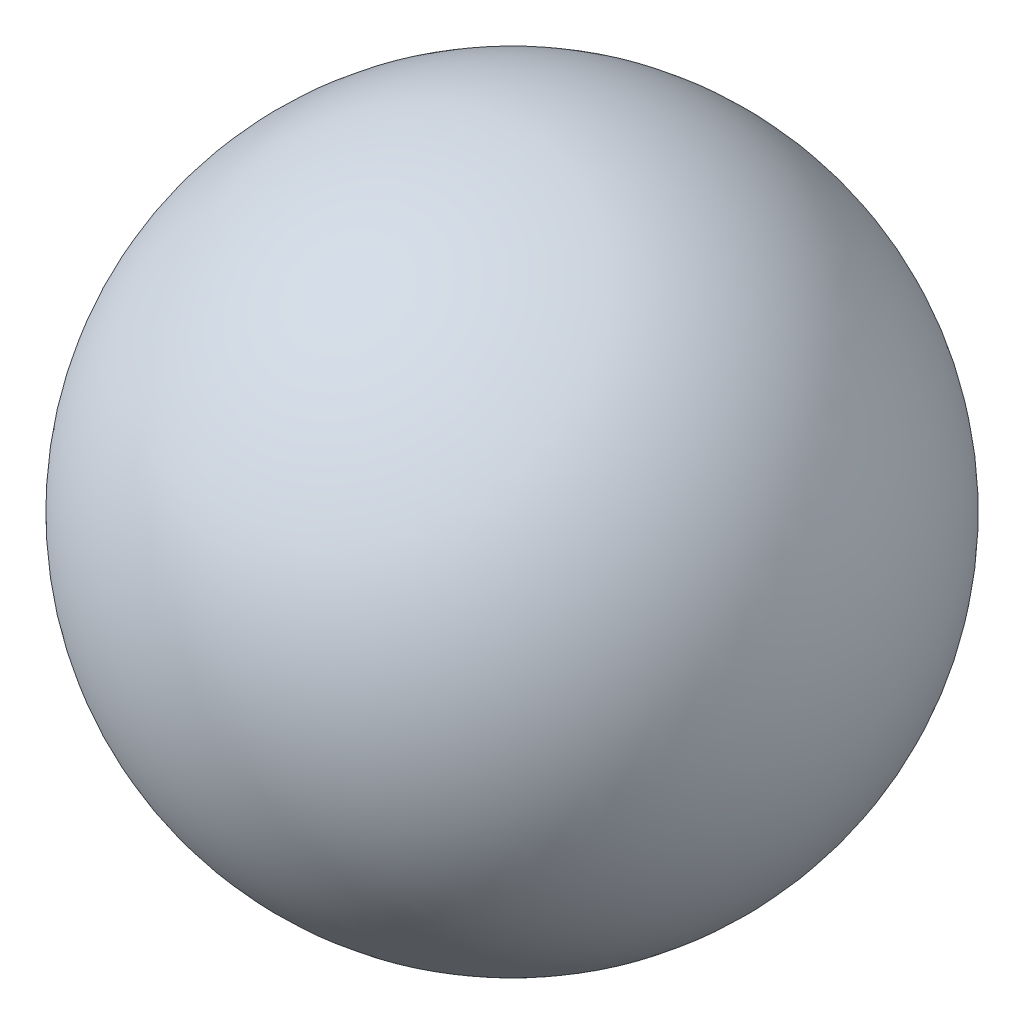
from build123d import *


with BuildPart() as part:
    # Sketch1 → Revolve1 (revolve)
    with BuildSketch(Plane.XY):
        with BuildLine():
            Line((0, 810), (0, -810))
            ThreePointArc((0, -810), (810, 0), (0, 810))
        make_face()
    revolve(axis=Axis((0, 810, 0), (0, -1, 0)))


solid = part.part
